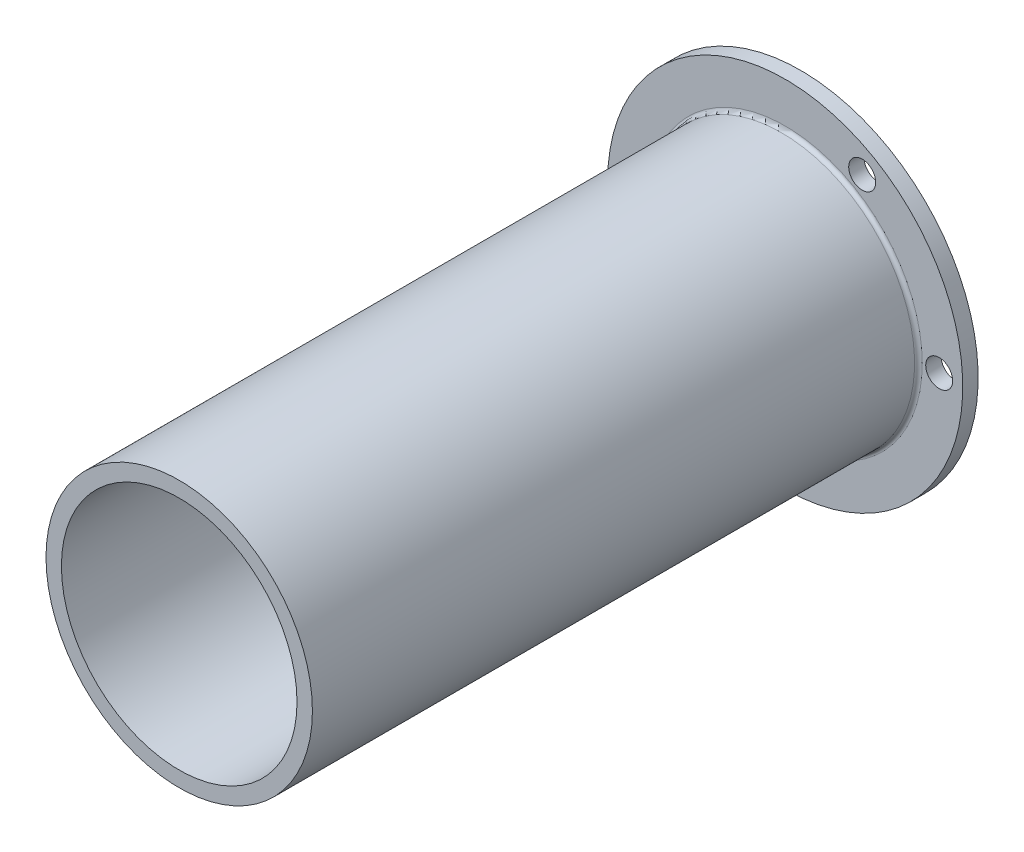
from build123d import *
from build123d.topology import SkipClean

# Parameters (mm, degrees)
SKETCH1_R           = 8.65
SKETCH1_R_2         = 7.65
BOSS_EXTRUDE1_DEPTH = 39.35
BOSS_EXTRUDE2_START = 1
SKETCH2_R           = 11.53
SKETCH2_R_2         = 7.65
BOSS_EXTRUDE2_DEPTH = 1
CIRPATTERN1_COUNT   = 6
FILLET1_R           = 0.25


with BuildPart() as part:
    # Sketch1 → Boss-Extrude1 (new body)
    with BuildSketch(Plane.XY):
        Circle(SKETCH1_R)
        Circle(SKETCH1_R_2, mode=Mode.SUBTRACT)
    extrude(amount=BOSS_EXTRUDE1_DEPTH)

    # Sketch2 → Boss-Extrude2 (add)
    with SkipClean():  # the faces are left unmerged after this step: merging them gives an invalid solid
        with BuildSketch(Plane(origin=(0, 0, 0), x_dir=(-1, 0, 0), z_dir=(0, 0, -1)).offset(BOSS_EXTRUDE2_START)):
            Circle(SKETCH2_R)
            Circle(SKETCH2_R_2, mode=Mode.SUBTRACT)
        extrude(amount=-BOSS_EXTRUDE2_DEPTH)

    # Sketch11 → Ø2.0mm Dowel Hole1 (revolve, cut)
    with SkipClean():  # the faces are left unmerged after this step: merging them gives an invalid solid
        with BuildSketch(Plane(origin=(-10, 0, 0), x_dir=(0, -1, 0), z_dir=(1, 0, 0))):
            Polygon((0, 0), (0, 5.525753042), (0.875, 5), (0.875, 0), align=None)
        f_2_0mm_dowel_hole1 = revolve(axis=Axis((-10, 0, 6.35), (0, 0, -1)), mode=Mode.SUBTRACT)

    # CirPattern1: Ø2.0mm Dowel Hole1 ×6 about axis, 2 skipped
    with SkipClean():  # the faces are left unmerged after this step: merging them gives an invalid solid
        cirpattern1_axis = Axis((0, 0, 0), (0, 0, -1))
        add([f_2_0mm_dowel_hole1.rotate(cirpattern1_axis, i * 360 / CIRPATTERN1_COUNT) for i in range(1, CIRPATTERN1_COUNT) if i not in (1, 4)], mode=Mode.SUBTRACT)

    # Fillet1
    fillet1_edges = [part.edges().sort_by_distance(p)[0] for p in [
        (-8.65, 0, 0),
    ]]
    fillet(fillet1_edges, radius=FILLET1_R)


solid = part.part
